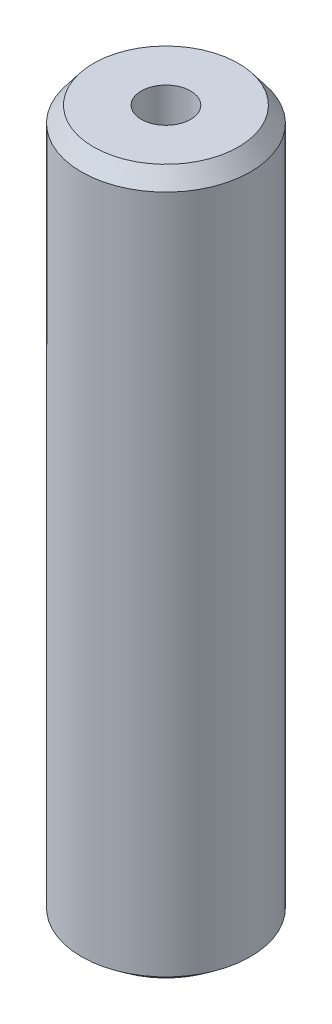
from build123d import *
from OCP.BRepFilletAPI import BRepFilletAPI_MakeChamfer

# Parameters (mm, degrees)
SKETCH1_R           = 25
BOSS_EXTRUDE1_DEPTH = 209.308155485
SKETCH2_R           = 7.299553899
CUT_EXTRUDE1_DEPTH  = 213.273182368
CHAMFER1_SIZE       = 4.621975204
CHAMFER1_SIZE2      = 3.553129181


with BuildPart() as part:
    # Sketch1 → Boss-Extrude1 (new body)
    with BuildSketch(Plane(origin=(0, 0, 0), x_dir=(1, 0, 0), z_dir=(0, 1, 0))):
        Circle(SKETCH1_R)
    extrude(amount=BOSS_EXTRUDE1_DEPTH)

    # Sketch2 → Cut-Extrude1 (cut, through all)
    with BuildSketch(Plane(origin=(0, 0, 0), x_dir=(1, 0, 0), z_dir=(0, 1, 0))):
        Circle(SKETCH2_R)
    extrude(amount=CUT_EXTRUDE1_DEPTH, mode=Mode.SUBTRACT)

    # Chamfer1: one chamfer whose edges measure the first distance from different faces: ONE call of the kernel's chamfer builder (chamfer() names one face for all edges)
    chamfer1_edges_1 = [part.edges().sort_by_distance(p)[0] for p in [
        (-25, 209.308155485, 0),
    ]]
    chamfer1_side_1 = [part.faces().sort_by_distance(p)[0] for p in [
        (-25, 104.654077743, 0),
    ]]
    chamfer1_edges_2 = [part.edges().sort_by_distance(p)[0] for p in [
        (-25, 0, 0),
    ]]
    chamfer1_side_2 = [part.faces().sort_by_distance(p)[0] for p in [
        (-24.292893219, 0, 0),
    ]]
    chamfer1 = BRepFilletAPI_MakeChamfer(part.part.solid().wrapped)
    for e in chamfer1_edges_1:
        chamfer1.Add(CHAMFER1_SIZE, CHAMFER1_SIZE2, e.wrapped, chamfer1_side_1[0].wrapped)  # the first distance lies on this face
    for e in chamfer1_edges_2:
        chamfer1.Add(CHAMFER1_SIZE, CHAMFER1_SIZE2, e.wrapped, chamfer1_side_2[0].wrapped)  # the first distance lies on this face
    add(Compound.cast(chamfer1.Shape()), mode=Mode.REPLACE)


solid = part.part
